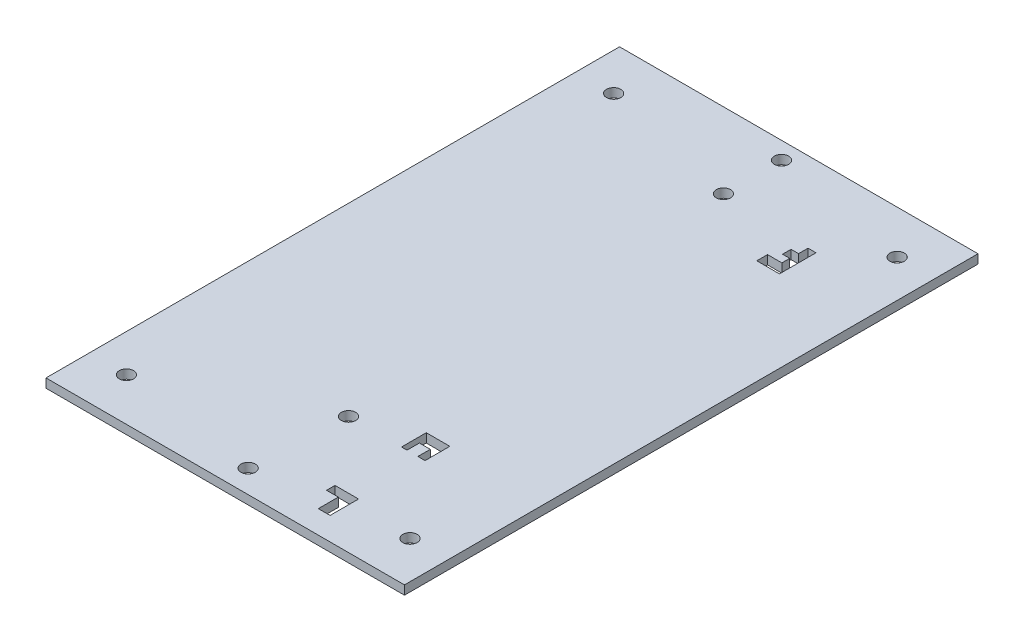
from build123d import *

# Parameters (mm, degrees)
SKETCH1_W           = 254
SKETCH1_H           = 406.4
SKETCH1_R           = 5.08
BOSS_EXTRUDE1_DEPTH = 6.35


with BuildPart() as part:
    # Sketch1 → Boss-Extrude1 (new body)
    with BuildSketch(Plane(origin=(0, 0, 0), x_dir=(1, 0, 0), z_dir=(0, 1, 0))):
        with Locations((0, 76.684199082)):
            Rectangle(SKETCH1_W, SKETCH1_H)
        with Locations((-100.457, -96.068481922)):
            Circle(SKETCH1_R, mode=Mode.SUBTRACT)
        with Locations((100.457, -96.068481922)):
            Circle(SKETCH1_R, mode=Mode.SUBTRACT)
        with Locations((0, 226.511523575)):
            Circle(SKETCH1_R, mode=Mode.SUBTRACT)
        with Locations((0, 267.659513913)):
            Circle(SKETCH1_R, mode=Mode.SUBTRACT)
        with Locations((-100.457, 249.148548959)):
            Circle(SKETCH1_R, mode=Mode.SUBTRACT)
        with Locations((100.457, 249.148548959)):
            Circle(SKETCH1_R, mode=Mode.SUBTRACT)
        with Locations((3.810013227, -42.951444708)):
            Circle(SKETCH1_R, mode=Mode.SUBTRACT)
        with Locations((0, -110.261456825)):
            Circle(SKETCH1_R, mode=Mode.SUBTRACT)
        Polygon((69.012885603, 197.173617012), (52.948455079, 197.173617012), (52.948455079, 204.798194528), (63.135298998, 204.798194528), (63.135298998, 210.354654847), (58.041877039, 210.354654847), (58.041877039, 216.374153526), (63.366818178, 216.374153526), (63.366818178, 223.088209746), (69.012885603, 223.088209746), align=None, mode=Mode.SUBTRACT)
        Polygon((41.345742309, -42.951444708), (41.345742309, -25.410434465), (58.041877039, -25.410434465), (58.041877039, -42.951444708), (52.948455079, -42.951444708), (52.948455079, -34.180939586), (45.23941523, -34.180939586), (45.23941523, -42.951444708), align=None, mode=Mode.SUBTRACT)
        Polygon((58.041877039, -110.261456825), (58.041877039, -90.093932087), (41.345742309, -90.093932087), (41.345742309, -96.068481922), (49.693809674, -96.068481922), (49.693809674, -110.261456825), align=None, mode=Mode.SUBTRACT)
    extrude(amount=BOSS_EXTRUDE1_DEPTH)


solid = part.part
